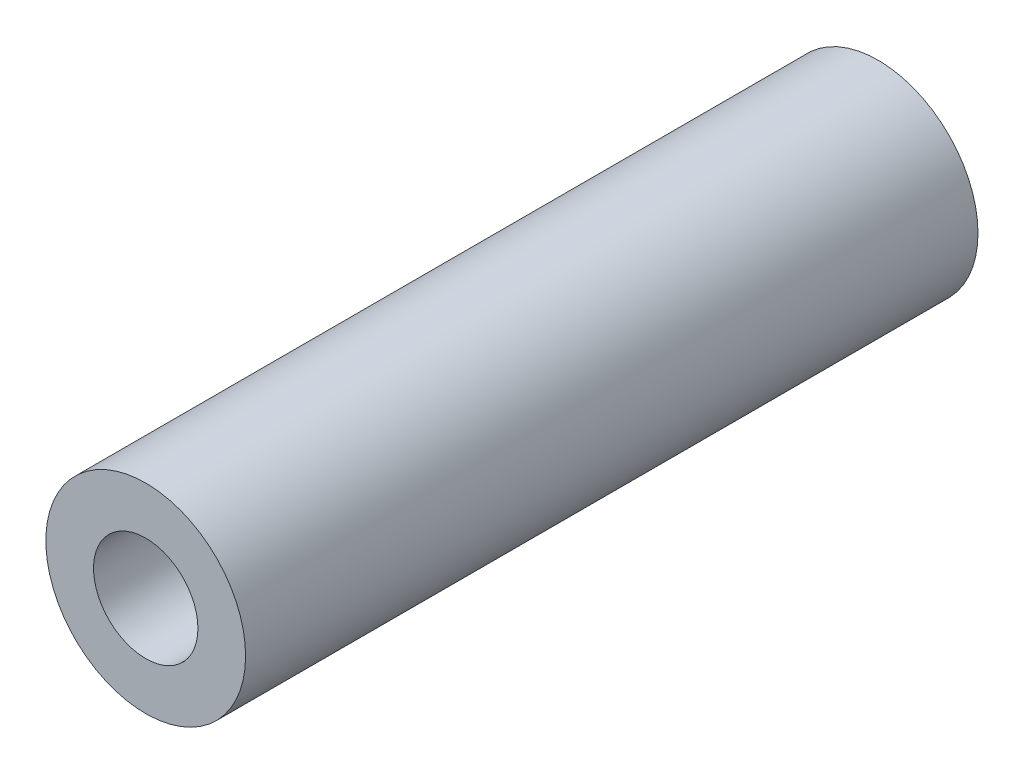
from build123d import *

# Parameters (mm, degrees)
SKETCH1_R           = 4.7625
SKETCH1_R_2         = 2.4892
BOSS_EXTRUDE1_DEPTH = 17.4625


with BuildPart() as part:
    # Sketch1 → Boss-Extrude1 (new, symmetric)
    with BuildSketch(Plane.XY):
        Circle(SKETCH1_R)
        Circle(SKETCH1_R_2, mode=Mode.SUBTRACT)
    extrude(amount=BOSS_EXTRUDE1_DEPTH, both=True)


solid = part.part
